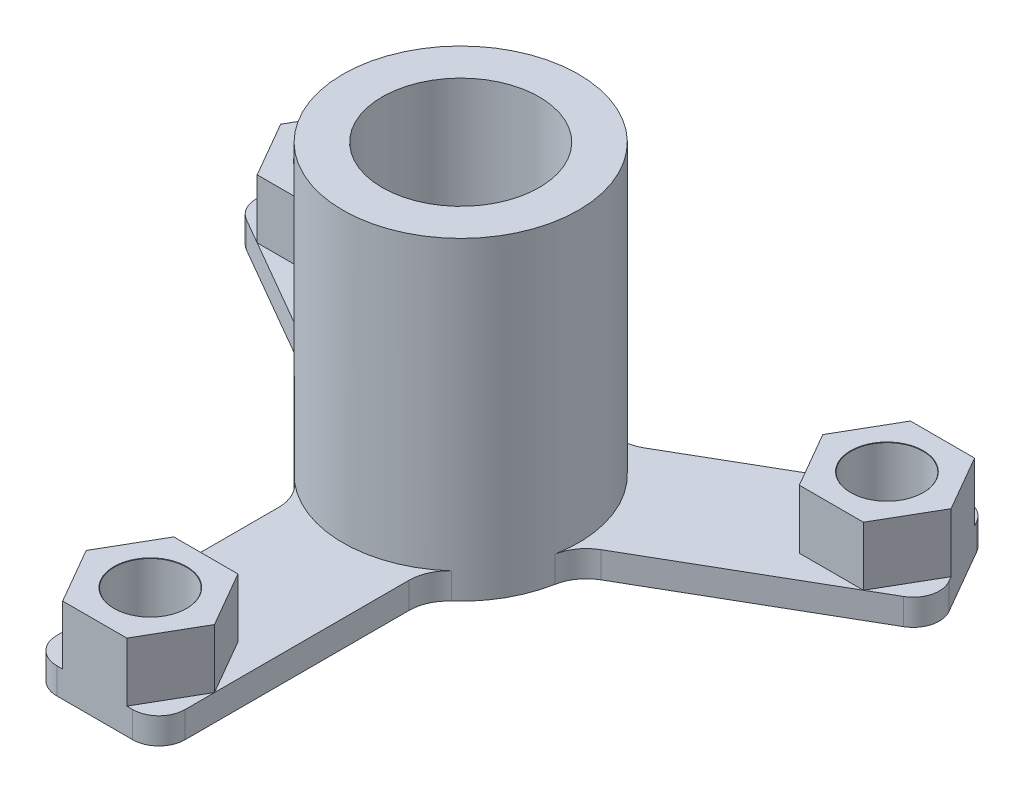
from build123d import *

# Parameters (mm, degrees)
ESQUISSE2_R                  = 9
BOSS_EXTRU_1_DEPTH           = 22
ESQUISSE5_R                  = 5
BOSS_EXTRU_3_DEPTH           = 2
ESQUISSE6_R                  = 6
ENL_V_MAT_EXTRU_2_DEPTH      = 14
ESQUISSE7_R                  = 4
ENL_V_MAT_EXTRU_3_DEPTH      = 19.920887928
ESQUISSE8_R                  = 5
ENL_V_MAT_EXTRU_4_DEPTH      = 0.7
ENL_V_START                  = -0.7
ESQUISSE9_R                  = 5
ENL_V_MAT_EXTRU_5_DEPTH      = 0.7
BOSS_EXTRU_4_START           = 2
ESQUISSE11_R                 = 9
ESQUISSE11_R_2               = 5
BOSS_EXTRU_4_DEPTH           = 2
BOSS_EXTRU_5_DEPTH           = 2
R_P_TITION_CIRCULAIRE1_COUNT = 3
BOSS_EXTRU_6_DEPTH           = 6.5
R_P_TITION_CIRCULAIRE2_COUNT = 3
D_GAGEMENT_M51_D             = 5.5
D_GAGEMENT_M51_CSINK_D       = 5.55
D_GAGEMENT_M51_CSINK_ANGLE   = 90
R_P_TITION_CIRCULAIRE3_COUNT = 3
CONG_1_R                     = 3
CONG_2_R                     = 3
CONG_3_R                     = 2


with BuildPart() as part:
    # Esquisse2 → Boss.-Extru.1 (new body)
    with BuildSketch(Plane(origin=(0, 0, 0), x_dir=(1, 0, 0), z_dir=(0, 1, 0))):
        Circle(ESQUISSE2_R)
    extrude(amount=BOSS_EXTRU_1_DEPTH)

    # Esquisse5 → Boss.-Extru.3 (add)
    with BuildSketch(Plane(origin=(0, 22, 0), x_dir=(1, 0, 0), z_dir=(0, 1, 0))):
        Circle(ESQUISSE5_R)
    extrude(amount=-BOSS_EXTRU_3_DEPTH)

    # Esquisse6 → Enlèv. mat.-Extru.2 (cut)
    with BuildSketch(Plane(origin=(0, 22, 0), x_dir=(1, 0, 0), z_dir=(0, 1, 0))):
        Circle(ESQUISSE6_R)
    extrude(amount=-ENL_V_MAT_EXTRU_2_DEPTH, mode=Mode.SUBTRACT)

    # Esquisse7 → Enlèv. mat.-Extru.3 (cut, through all)
    with BuildSketch(Plane(origin=(0, 8, 0), x_dir=(1, 0, 0), z_dir=(0, 1, 0))):
        Circle(ESQUISSE7_R)
    extrude(amount=-ENL_V_MAT_EXTRU_3_DEPTH, mode=Mode.SUBTRACT)

    # Esquisse8 → Enlèv. mat.-Extru.4 (cut)
    with BuildSketch(Plane.XZ):
        Circle(ESQUISSE8_R)
    extrude(amount=-ENL_V_MAT_EXTRU_4_DEPTH, mode=Mode.SUBTRACT)

    # Esquisse9 → Enlèv. mat.-Extru.5 (cut)
    with BuildSketch(Plane(origin=(0, 8, 0), x_dir=(1, 0, 0), z_dir=(0, 1, 0)).offset(ENL_V_START)):
        Circle(ESQUISSE9_R)
    extrude(amount=ENL_V_MAT_EXTRU_5_DEPTH, mode=Mode.SUBTRACT)

    # Esquisse11 → Boss.-Extru.4 (add)
    with BuildSketch(Plane.XZ.offset(BOSS_EXTRU_4_START)):
        Circle(ESQUISSE11_R)
        Circle(ESQUISSE11_R_2, mode=Mode.SUBTRACT)
    extrude(amount=-BOSS_EXTRU_4_DEPTH)

    # Esquisse12 → Boss.-Extru.5 (add)
    with BuildSketch(Plane.XZ.offset(2)):
        with BuildLine():
            Line((-4.8, 2.012544091), (-4.8, 28.05))
            Line((-4.8, 28.05), (5, 28.05))
            Line((5, 28.05), (5, 1.445798644))
            ThreePointArc((5, 1.445798644), (0.300499751, 5.196155658), (-4.8, 2.012544091))
        make_face()
    boss_extru_5 = extrude(amount=-BOSS_EXTRU_5_DEPTH)

    # Répétition circulaire1: Boss.-Extru.5 ×3 about axis
    r_p_tition_circulaire1_axis = Axis((0, 0, 0), (0, 1, 0))
    for i in range(1, R_P_TITION_CIRCULAIRE1_COUNT):
        add(boss_extru_5.rotate(r_p_tition_circulaire1_axis, i * 360 / R_P_TITION_CIRCULAIRE1_COUNT))

    # Esquisse13 → Boss.-Extru.6 (add)
    with BuildSketch(Plane.XZ.offset(2)):
        Polygon((-2.35, 28.05), (-4.8, 23.806475521), (-2.35, 19.562951043), (2.55, 19.562951043), (5, 23.806475521), (2.55, 28.05), align=None)
    boss_extru_6 = extrude(amount=-BOSS_EXTRU_6_DEPTH)

    # Répétition circulaire2: Boss.-Extru.6 ×3 about axis
    r_p_tition_circulaire2_axis = Axis((0, 0, 0), (0, 1, 0))
    for i in range(1, R_P_TITION_CIRCULAIRE2_COUNT):
        add(boss_extru_6.rotate(r_p_tition_circulaire2_axis, i * 360 / R_P_TITION_CIRCULAIRE2_COUNT))

    # Dégagement M51 (through all)
    with Locations(Plane(origin=(0, 4.5, 0), x_dir=(1, 0, 0), z_dir=(0, 1, 0))):
        with Locations((0.1, -23.806475521)):
            d_gagement_m51 = CounterSinkHole(D_GAGEMENT_M51_D / 2, D_GAGEMENT_M51_CSINK_D / 2, counter_sink_angle=D_GAGEMENT_M51_CSINK_ANGLE)

    # Répétition circulaire3: Dégagement M51 ×3 about axis
    r_p_tition_circulaire3_axis = Axis((0, 22, 0), (0, -1, 0))
    for i in range(1, R_P_TITION_CIRCULAIRE3_COUNT):
        add(d_gagement_m51.rotate(r_p_tition_circulaire3_axis, i * 360 / R_P_TITION_CIRCULAIRE3_COUNT), mode=Mode.SUBTRACT)

    # Congé1
    cong_1_edges = [part.edges().sort_by_distance(p)[0] for p in [
        (-4.8, -1, 7.613146524),
    ]]
    fillet(cong_1_edges, radius=CONG_1_R)

    # Congé2
    cong_2_edges = [part.edges().sort_by_distance(p)[0] for p in [
        (-4.193178293, -1, -7.9634952),
        (3.980740698, -1, -8.071784406),
        (8.993178293, -1, 0.350348676),
        (5, -1, 7.483314774),
        (-8.980740698, -1, 0.588469632),
    ]]
    fillet(cong_2_edges, radius=CONG_2_R)

    # Congé3
    cong_3_edges = [part.edges().sort_by_distance(p)[0] for p in [
        (-21.892012576, -1, -18.181921938),
        (-26.792012576, -1, -9.694872981),
        (-4.8, -1, 28.05),
        (5, -1, 28.05),
        (26.692012576, -1, -9.868078062),
        (21.792012576, -1, -18.355127019),
    ]]
    fillet(cong_3_edges, radius=CONG_3_R)


solid = part.part
